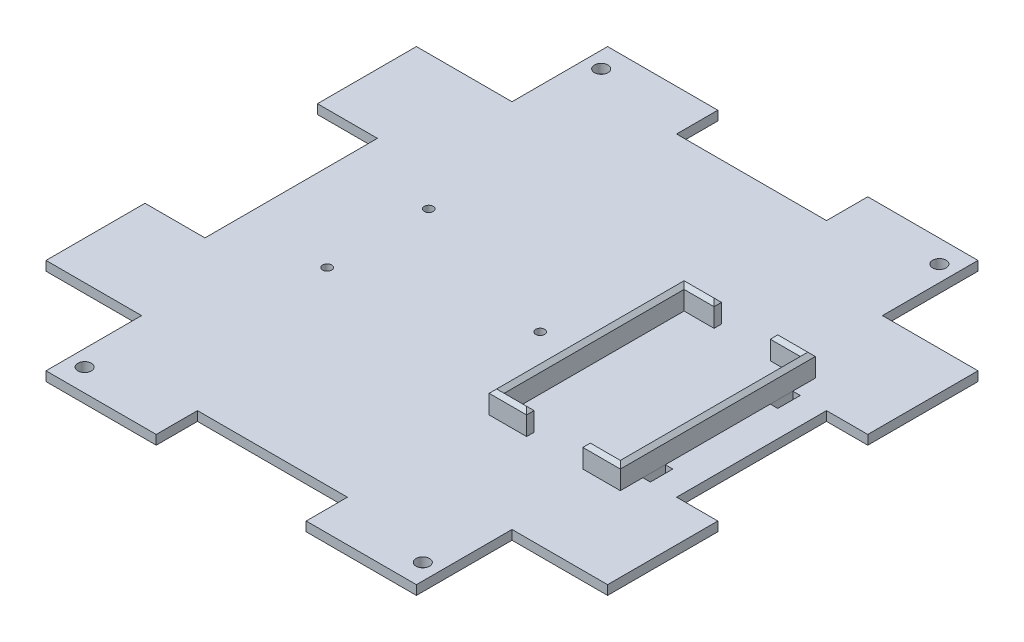
from build123d import *

# Parameters (mm, degrees)
BOSS_EXTRUDE1_DEPTH   = 3.175
SKETCH2_R             = 2.286
CUT_EXTRUDE1_DEPTH    = 163.910922896
SKETCH3_W             = 20.32
SKETCH3_H             = 58.42
SKETCH3_W_2           = 50.8
SKETCH3_H_2           = 13.97
SKETCH3_W_3           = 13.97
SKETCH3_H_3           = 50.8
CUT_EXTRUDE2_DEPTH    = 163.910922896
BOSS_EXTRUDE2_DEPTH   = 7.62
BOSS_EXTRUDE2_2_DEPTH = 7.62
CHAMFER1_SIZE         = 1.27
CHAMFER2_SIZE         = 1.27
SKETCH5_W             = 2.54
SKETCH5_H             = 7.62
CUT_EXTRUDE3_DEPTH    = 164.058126366
SKETCH6_R             = 1.524
CUT_EXTRUDE4_DEPTH    = 8.89


with BuildPart() as part:
    # Sketch1 → Boss-Extrude1 (new body)
    with BuildSketch(Plane(origin=(0, 0, 0), x_dir=(1, 0, 0), z_dir=(0, 1, 0))):
        Polygon((-62.22816, -68.31704), (-29.84616, -68.31704), (-29.84616, -100.69904), (95.63984, -100.69904), (95.63984, -68.31704), (128.02184, -68.31704), (128.02184, 57.16896), (95.63984, 57.16896), (95.63984, 89.55096), (-29.84616, 89.55096), (-29.84616, 57.16896), (-62.22816, 57.16896), align=None)
    extrude(amount=BOSS_EXTRUDE1_DEPTH)

    # Sketch2 → Cut-Extrude1 (cut, through all)
    with BuildSketch(Plane(origin=(0, 3.175, 0), x_dir=(1, 0, 0), z_dir=(0, 1, 0))):
        with Locations(Location((-24.38516, 81.93096, 0), (0, 0, 270))):
            Circle(SKETCH2_R)
        with Locations(Location((90.17884, 81.93096, 0), (0, 0, 270))):
            Circle(SKETCH2_R)
        with Locations(Location((90.17884, -93.07904, 0), (0, 0, 270))):
            Circle(SKETCH2_R)
        with Locations(Location((-24.38516, -93.07904, 0), (0, 0, 270))):
            Circle(SKETCH2_R)
    extrude(amount=-CUT_EXTRUDE1_DEPTH, mode=Mode.SUBTRACT)

    # Sketch3 → Cut-Extrude2 (cut, through all)
    with BuildSketch(Plane(origin=(0, 3.175, 0), x_dir=(1, 0, 0), z_dir=(0, 1, 0))):
        with Locations((-52.06816, -5.57404)):
            Rectangle(SKETCH3_W, SKETCH3_H)
        with Locations((32.89684, 82.56596)):
            Rectangle(SKETCH3_W_2, SKETCH3_H_2)
        with Locations((121.03684, -5.57404)):
            Rectangle(SKETCH3_W_3, SKETCH3_H_3)
        with Locations((32.89684, -93.71404)):
            Rectangle(SKETCH3_W_2, SKETCH3_H_2)
    extrude(amount=-CUT_EXTRUDE2_DEPTH, mode=Mode.SUBTRACT)

    # Sketch5 → Cut-Extrude3 (cut, through all)
    with BuildSketch(Plane(origin=(0, 3.175, 0), x_dir=(1, 0, 0), z_dir=(0, 1, 0))):
        with Locations((56.90184, 16.01596)):
            Rectangle(SKETCH5_W, SKETCH5_H)
        with Locations((56.90184, -27.16404)):
            Rectangle(SKETCH5_W, SKETCH5_H)
        with Locations((103.89184, -27.16404)):
            Rectangle(SKETCH5_W, SKETCH5_H)
        with Locations((103.89184, 16.01596)):
            Rectangle(SKETCH5_W, SKETCH5_H)
    extrude(amount=-CUT_EXTRUDE3_DEPTH, mode=Mode.SUBTRACT)

    # Sketch6 → Cut-Extrude4 (cut)
    with BuildSketch(Plane(origin=(0, 3.175, 0), x_dir=(1, 0, 0), z_dir=(0, 1, 0))):
        with Locations(Location((42.44524, -5.57404, 0), (0, 0, 270))):
            Circle(SKETCH6_R)
        with Locations(Location((-12.50816, -22.78254, 0), (0, 0, 270))):
            Circle(SKETCH6_R)
        with Locations(Location((-12.50816, 11.63446, 0), (0, 0, 270))):
            Circle(SKETCH6_R)
    extrude(amount=-CUT_EXTRUDE4_DEPTH, mode=Mode.SUBTRACT)


with BuildPart() as body_2:
    # Sketch4 → Boss-Extrude2 (new body)
    with BuildSketch(Plane(origin=(0, 3.175, 0), x_dir=(1, 0, 0), z_dir=(0, 1, 0))):
        Polygon((60.71184, 24.90596), (70.87184, 24.90596), (70.87184, 27.44596), (58.17184, 27.44596), (58.17184, -38.59404), (70.87184, -38.59404), (70.87184, -36.05404), (60.71184, -36.05404), align=None)
    extrude(amount=BOSS_EXTRUDE2_DEPTH)

    # Chamfer1
    chamfer1_edges = [body_2.edges().sort_by_distance(p)[0] for p in [
        (70.87184, 10.795, -26.17596),
        (64.52184, 10.795, -27.44596),
        (58.17184, 10.795, 5.57404),
        (64.52184, 10.795, 38.59404),
        (70.87184, 10.795, 37.32404),
        (65.79184, 10.795, 36.05404),
        (60.71184, 10.795, 5.57404),
        (65.79184, 10.795, -24.90596),
    ]]
    chamfer(chamfer1_edges, length=CHAMFER1_SIZE - 0.0001)  # a hair under: the kernel refuses the full size


with BuildPart() as body_3:
    # Sketch4 → Boss-Extrude2 2 (new body)
    with BuildSketch(Plane(origin=(0, 3.175, 0), x_dir=(1, 0, 0), z_dir=(0, 1, 0))):
        Polygon((100.08184, 24.90596), (100.08184, -36.05404), (89.92184, -36.05404), (89.92184, -38.59404), (102.62184, -38.59404), (102.62184, 27.44596), (89.92184, 27.44596), (89.92184, 24.90596), align=None)
    extrude(amount=BOSS_EXTRUDE2_2_DEPTH)

    # Chamfer2
    chamfer2_edges = [body_3.edges().sort_by_distance(p)[0] for p in [
        (96.27184, 10.795, 38.59404),
        (102.62184, 10.795, 5.57404),
        (96.27184, 10.795, -27.44596),
        (89.92184, 10.795, -26.17596),
        (95.00184, 10.795, -24.90596),
        (100.08184, 10.795, 5.57404),
        (95.00184, 10.795, 36.05404),
        (89.92184, 10.795, 37.32404),
    ]]
    chamfer(chamfer2_edges, length=CHAMFER2_SIZE - 0.0001)  # a hair under: the kernel refuses the full size


solid = Compound([part.part, body_2.part, body_3.part])
